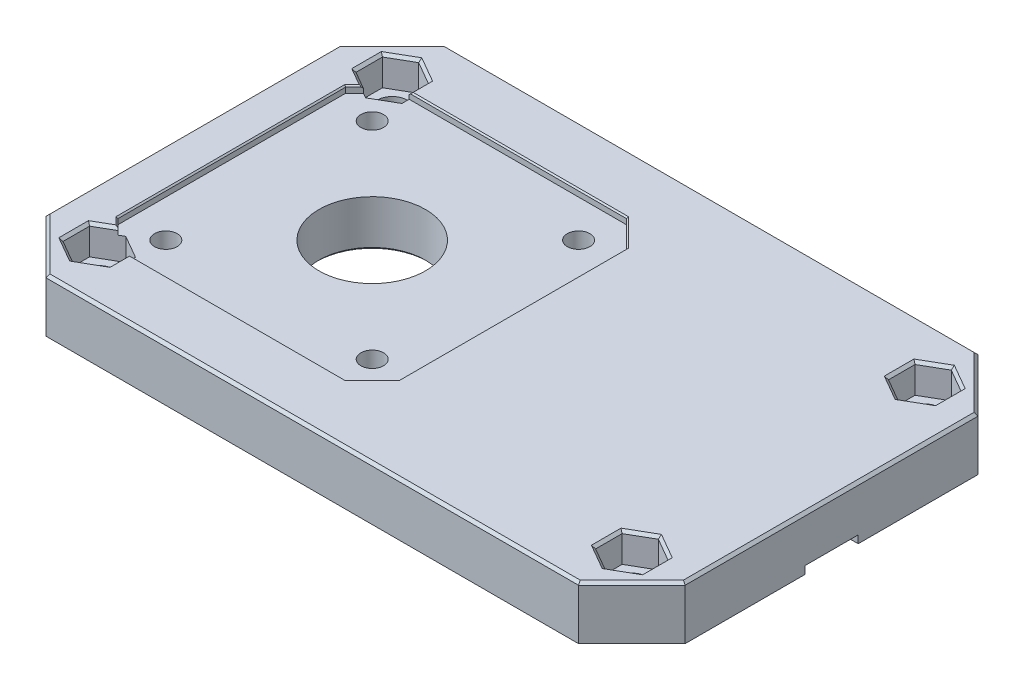
from build123d import *

# Parameters (mm, degrees)
SKETCH1_W                        = 96
SKETCH1_H                        = 60
BOSS_EXTRUDE1_DEPTH              = 8
CHAMFER1_SIZE                    = 8
HOLE2_D                          = 16
SKETCH6_R                        = 8
CUT_EXTRUDE1_DEPTH               = 7
CBORE_FOR_M3_SHCS1_OUTLINE_R     = 3.25
CBORE_FOR_M3_SHCS1_DEPTH         = 3.2
CBORE_START                      = 3.2
CBORE_FOR_M3_SHCS1_2_OUTLINE_R   = 1.7
CBORE_FOR_M3_SHCS1_2_DEPTH       = 4.8
CHAMFER3_SIZE                    = 0.4
SKETCH10_R                       = 3
SKETCH10_R_2                     = 2.25
BOSS_EXTRUDE2_DEPTH              = 2
CHAMFER4_SIZE                    = 0.2
CHAMFER4_OF_SKETCH_PATTERN1_SIZE = 0.2
CUT_EXTRUDE2_DEPTH               = 4
SKETCH14_R                       = 4.025
SKETCH14_R_2                     = 2.25
BOSS_EXTRUDE3_DEPTH              = 4.2
CUT_EXTRUDE3_DEPTH               = 4.4
CHAMFER6_SIZE                    = 0.4
CHAMFER7_SIZE                    = 0.4
CUT_EXTRUDE4_DEPTH               = 1
CHAMFER8_SIZE                    = 0.2


# Read off the part's stored shape, not the designer's step: CBORE for M4 SHCS1, CBORE for M3 SHCS1
with BuildPart() as part:
    # Sketch1 → Boss-Extrude1 (new body)
    with BuildSketch(Plane(origin=(0, 0, 0), x_dir=(1, 0, 0), z_dir=(0, 1, 0))):
        Rectangle(SKETCH1_W, SKETCH1_H)
    extrude(amount=BOSS_EXTRUDE1_DEPTH)

    # CBORE for M4 SHCS1 outline → CBORE for M4 SHCS1 (revolve, cut)
    with BuildSketch(Plane(origin=(40, 0, 22), x_dir=(1, 0, 0), z_dir=(0, 0, 1))):
        Polygon((0, 0), (2.25, 0), (2.25, 3.8), (4, 3.8), (4, 7.975), (4.025, 8), (0, 8), align=None)
    revolve(axis=Axis((40, 0, 22), (0, 1, 0)), mode=Mode.SUBTRACT)

    # CBORE for M4 SHCS1 2 outline → CBORE for M4 SHCS1 2 (revolve, cut)
    with BuildSketch(Plane(origin=(-40, 0, -22), x_dir=(1, 0, 0), z_dir=(0, 0, 1))):
        Polygon((0, 8), (0, 0), (2.25, 0), (2.25, 3.8), (4, 3.8), (4, 7.975), (4.025, 8), align=None)
    revolve(axis=Axis((-40, 0, -22), (0, 1, 0)), mode=Mode.SUBTRACT)

    # CBORE for M4 SHCS1 3 outline → CBORE for M4 SHCS1 3 (revolve, cut)
    with BuildSketch(Plane(origin=(-40, 0, 22), x_dir=(1, 0, 0), z_dir=(0, 0, 1))):
        Polygon((0, 8), (0, 0), (2.25, 0), (2.25, 3.8), (4, 3.8), (4, 7.975), (4.025, 8), align=None)
    revolve(axis=Axis((-40, 0, 22), (0, 1, 0)), mode=Mode.SUBTRACT)

    # CBORE for M4 SHCS1 4 outline → CBORE for M4 SHCS1 4 (revolve, cut)
    with BuildSketch(Plane(origin=(40, 0, -22), x_dir=(1, 0, 0), z_dir=(0, 0, 1))):
        Polygon((0, 8), (0, 0), (2.25, 0), (2.25, 3.8), (4, 3.8), (4, 7.975), (4.025, 8), align=None)
    revolve(axis=Axis((40, 0, -22), (0, 1, 0)), mode=Mode.SUBTRACT)

    # Chamfer1
    chamfer1_edges = [part.edges().sort_by_distance(p)[0] for p in [
        (48, 4, 30),
        (-48, 4, 30),
        (-48, 4, -30),
        (48, 4, -30),
    ]]
    chamfer(chamfer1_edges, length=CHAMFER1_SIZE)

    # Hole2 (through all)
    with Locations(Plane(origin=(0, 8, 0), x_dir=(1, 0, 0), z_dir=(0, 1, 0))):
        with Locations((-21, 0)):
            Hole(HOLE2_D / 2)

    # Sketch6 → Cut-Extrude1 (cut)
    with BuildSketch(Plane.XZ):
        with Locations(Location((21, 0, 0), (0, 0, 270))):
            Circle(SKETCH6_R)
    extrude(amount=-CUT_EXTRUDE1_DEPTH, mode=Mode.SUBTRACT)

    # CBORE for M3 SHCS1 outline → CBORE for M3 SHCS1 (cut)
    with BuildSketch(Plane(origin=(0, 0, 0), x_dir=(1, 0, 0), z_dir=(0, 1, 0))):
        with Locations((-5.5, 15.5)):
            Circle(CBORE_FOR_M3_SHCS1_OUTLINE_R)
        with Locations((-36.5, 15.5)):
            Circle(CBORE_FOR_M3_SHCS1_OUTLINE_R)
        with Locations((-36.5, -15.5)):
            Circle(CBORE_FOR_M3_SHCS1_OUTLINE_R)
        with Locations((-5.5, -15.5)):
            Circle(CBORE_FOR_M3_SHCS1_OUTLINE_R)
    extrude(amount=CBORE_FOR_M3_SHCS1_DEPTH, mode=Mode.SUBTRACT)

    # CBORE for M3 SHCS1 2 outline → CBORE for M3 SHCS1 2 (cut)
    with BuildSketch(Plane(origin=(0, 0, 0), x_dir=(1, 0, 0), z_dir=(0, 1, 0)).offset(CBORE_START)):
        with Locations((-5.5, 15.5)):
            Circle(CBORE_FOR_M3_SHCS1_2_OUTLINE_R)
        with Locations((-36.5, 15.5)):
            Circle(CBORE_FOR_M3_SHCS1_2_OUTLINE_R)
        with Locations((-36.5, -15.5)):
            Circle(CBORE_FOR_M3_SHCS1_2_OUTLINE_R)
        with Locations((-5.5, -15.5)):
            Circle(CBORE_FOR_M3_SHCS1_2_OUTLINE_R)
    extrude(amount=CBORE_FOR_M3_SHCS1_2_DEPTH, mode=Mode.SUBTRACT)

    # Chamfer3
    chamfer3_edges = [part.edges().sort_by_distance(p)[0] for p in [
        (-39.75, 0, 15.5),
        (-8.75, 0, 15.5),
        (37.75, 0, 22),
        (-42.25, 0, -22),
        (-42.25, 0, 22),
        (37.75, 0, -22),
        (-13, 0, 0),
        (-8.75, 0, -15.5),
        (-39.75, 0, -15.5),
    ]]
    chamfer(chamfer3_edges, length=CHAMFER3_SIZE)

    # Sketch10 → Boss-Extrude2 (add)
    with BuildSketch(Plane.XZ):
        with Locations(Location((-40, 22, 0), (0, 0, 270))):
            Circle(SKETCH10_R)
        with Locations(Location((-40, 22, 0), (0, 0, 90))):
            Circle(SKETCH10_R_2, mode=Mode.SUBTRACT)
    boss_extrude2 = extrude(amount=BOSS_EXTRUDE2_DEPTH)

    # Chamfer4
    chamfer4_edges = [part.edges().sort_by_distance(p)[0] for p in [
        (-40, -2, 25),
    ]]
    chamfer(chamfer4_edges, length=CHAMFER4_SIZE)

    # Sketch-Pattern1: Boss-Extrude2 at 3 more places
    with Locations((80, 0, 0), (80, 0, -44), (0, 0, -44)):
        add(boss_extrude2)

    # Chamfer4 of Sketch-Pattern1
    chamfer4_of_sketch_pattern1_edges = [part.edges().sort_by_distance(p)[0] for p in [
        (40, -2, 25),
        (40, -2, -19),
        (-40, -2, -19),
    ]]
    chamfer(chamfer4_of_sketch_pattern1_edges, length=CHAMFER4_OF_SKETCH_PATTERN1_SIZE)

    # Sketch13 → Cut-Extrude2 (cut, symmetric)
    with BuildSketch(Plane.XY):
        Polygon((-48, 0), (-46, 0), (-48, 1.154700538), align=None)
    cut_extrude2 = extrude(amount=CUT_EXTRUDE2_DEPTH, both=True, mode=Mode.SUBTRACT)

    # Mirror1: Cut-Extrude2 across plane
    add(cut_extrude2.mirror(Plane(origin=(0, 0, 0), x_dir=(0, 0, 1), z_dir=(1, 0, 0))), mode=Mode.SUBTRACT)

    # Sketch14 → Boss-Extrude3 (add)
    # profile 1 of 4: a face of its own
    with BuildSketch(Plane(origin=(0, 8, 0), x_dir=(1, 0, 0), z_dir=(0, 1, 0))):
        with Locations((40, 22)):
            Circle(SKETCH14_R)
        with Locations(Location((40, 22, 0), (0, 0, 270))):
            Circle(SKETCH14_R_2, mode=Mode.SUBTRACT)
    # profile 2 of 4: a face of its own
    with BuildSketch(Plane(origin=(0, 8, 0), x_dir=(1, 0, 0), z_dir=(0, 1, 0))):
        with Locations((-40, -22)):
            Circle(SKETCH14_R)
        with Locations(Location((-40, -22, 0), (0, 0, 270))):
            Circle(SKETCH14_R_2, mode=Mode.SUBTRACT)
    # profile 3 of 4: a face of its own
    with BuildSketch(Plane(origin=(0, 8, 0), x_dir=(1, 0, 0), z_dir=(0, 1, 0))):
        with Locations((-40, 22)):
            Circle(SKETCH14_R)
        with Locations(Location((-40, 22, 0), (0, 0, 270))):
            Circle(SKETCH14_R_2, mode=Mode.SUBTRACT)
    # profile 4 of 4: a face of its own
    with BuildSketch(Plane(origin=(0, 8, 0), x_dir=(1, 0, 0), z_dir=(0, 1, 0))):
        with Locations((40, -22)):
            Circle(SKETCH14_R)
        with Locations(Location((40, -22, 0), (0, 0, 270))):
            Circle(SKETCH14_R_2, mode=Mode.SUBTRACT)
    extrude(amount=-BOSS_EXTRUDE3_DEPTH)

    # Sketch15 → Cut-Extrude3 (cut)
    with BuildSketch(Plane(origin=(0, 8, 0), x_dir=(1, 0, 0), z_dir=(0, 1, 0))):
        Polygon((-40, 25.983716857), (-43.45, 23.991858429), (-43.45, 20.008141571), (-40, 18.016283143), (-36.55, 20.008141571), (-36.55, 23.991858429), align=None)
    cut_extrude3 = extrude(amount=-CUT_EXTRUDE3_DEPTH, mode=Mode.SUBTRACT)

    # Sketch-Pattern2: Cut-Extrude3 at 3 more places
    with Locations((0, 0, 44), (80, 0, 44), (80, 0, 0)):
        add(cut_extrude3, mode=Mode.SUBTRACT)

    # Chamfer6
    chamfer6_edges = [part.edges().sort_by_distance(p)[0] for p in [
        (-38.2, 8, 15.5),
        (-7.2, 8, 15.5),
        (-38.275, 8, -24.987787643),
        (-41.725, 8, -24.987787643),
        (-43.45, 8, -22),
        (-41.725, 8, -19.012212357),
        (-38.275, 8, -19.012212357),
        (-36.55, 8, -22),
        (41.725, 8, -24.987787643),
        (38.275, 8, -24.987787643),
        (36.55, 8, -22),
        (38.275, 8, -19.012212357),
        (41.725, 8, -19.012212357),
        (43.45, 8, -22),
        (41.725, 8, 19.012212357),
        (38.275, 8, 19.012212357),
        (36.55, 8, 22),
        (38.275, 8, 24.987787643),
        (41.725, 8, 24.987787643),
        (43.45, 8, 22),
        (-38.275, 8, 19.012212357),
        (-41.725, 8, 19.012212357),
        (-43.45, 8, 22),
        (-41.725, 8, 24.987787643),
        (-38.275, 8, 24.987787643),
        (-36.55, 8, 22),
        (48, 8, 0),
        (0, 8, 30),
        (0, 8, -30),
        (-48, 8, 0),
        (-44, 8, 26),
        (-44, 8, -26),
        (44, 8, -26),
        (44, 8, 26),
        (-13, 8, 0),
        (-7.2, 8, -15.5),
        (-38.2, 8, -15.5),
    ]]
    chamfer(chamfer6_edges, length=CHAMFER6_SIZE)

    # Chamfer7
    chamfer7_edges = [part.edges().sort_by_distance(p)[0] for p in [
        (21, 0, 8),
        (21, 7, 8),
    ]]
    chamfer(chamfer7_edges, length=CHAMFER7_SIZE)

    # Sketch16 → Cut-Extrude4 (cut)
    with BuildSketch(Plane(origin=(0, 8, 0), x_dir=(1, 0, 0), z_dir=(0, 1, 0))):
        Polygon((-42.1, 17.1), (-38.1, 21.1), (-3.9, 21.1), (0.1, 17.1), (0.1, -17.1), (-3.9, -21.1), (-38.1, -21.1), (-42.1, -17.1), align=None)
    extrude(amount=-CUT_EXTRUDE4_DEPTH, mode=Mode.SUBTRACT)

    # Chamfer8
    chamfer8_edges = [part.edges().sort_by_distance(p)[0] for p in [
        (-20.025, 8, -21.1),
        (-41.57163337, 8, -17.62836663),
        (-42.1, 8, 0),
        (-41.57163337, 8, 17.62836663),
        (-20.025, 8, 21.1),
        (-1.9, 8, 19.1),
        (0.1, 8, 0),
        (-1.9, 8, -19.1),
    ]]
    chamfer(chamfer8_edges, length=CHAMFER8_SIZE)


solid = part.part
